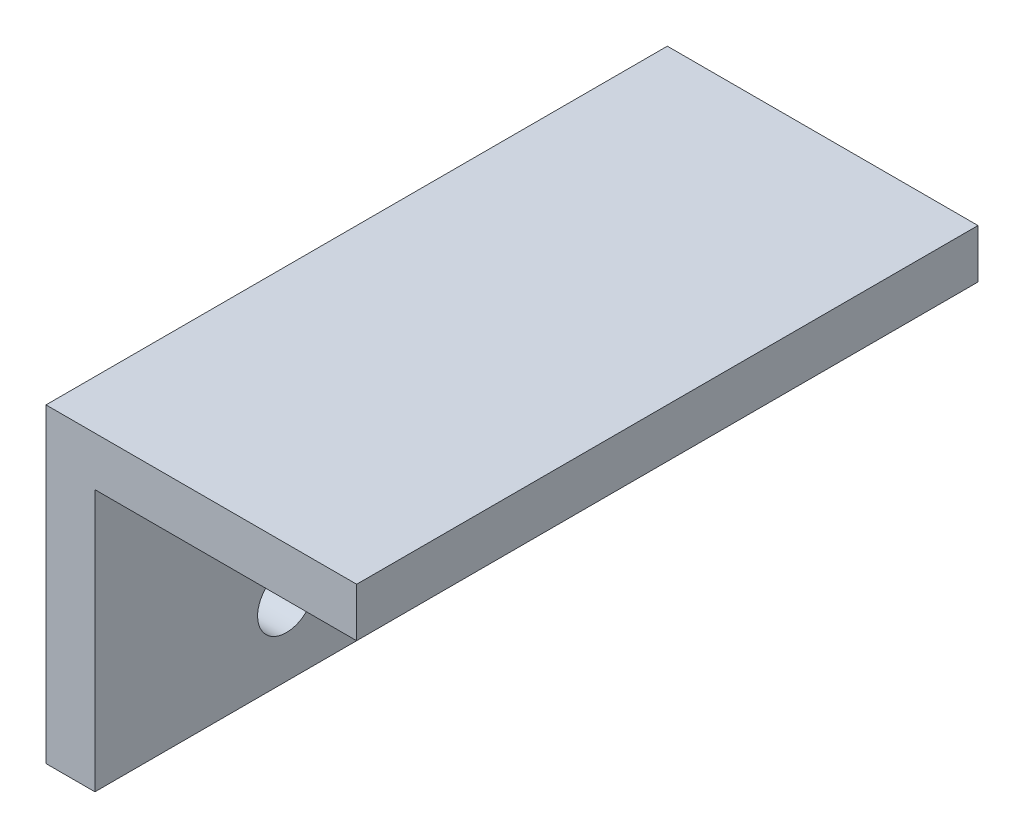
from build123d import *

# Parameters (mm, degrees)
BOSS_EXTRUDE1_DEPTH = 50.8
SKETCH2_R           = 2.35
CUT_EXTRUDE1_DEPTH  = 60.131717377


with BuildPart() as part:
    # Sketch1 → Boss-Extrude1 (new body)
    with BuildSketch(Plane.XY):
        Polygon((0, 0), (0, -21.4), (-4, -21.4), (-4, 4), (21.4, 4), (21.4, 0), align=None)
    extrude(amount=BOSS_EXTRUDE1_DEPTH)

    # Sketch2 → Cut-Extrude1 (cut, through all)
    with BuildSketch(Plane(origin=(0, 0, 0), x_dir=(0, 0, -1), z_dir=(1, 0, 0))):
        with Locations((-35.15, -15.6)):
            Circle(SKETCH2_R)
        with Locations((-15.65, -15.6)):
            Circle(SKETCH2_R)
    extrude(amount=-CUT_EXTRUDE1_DEPTH, mode=Mode.SUBTRACT)


solid = part.part
